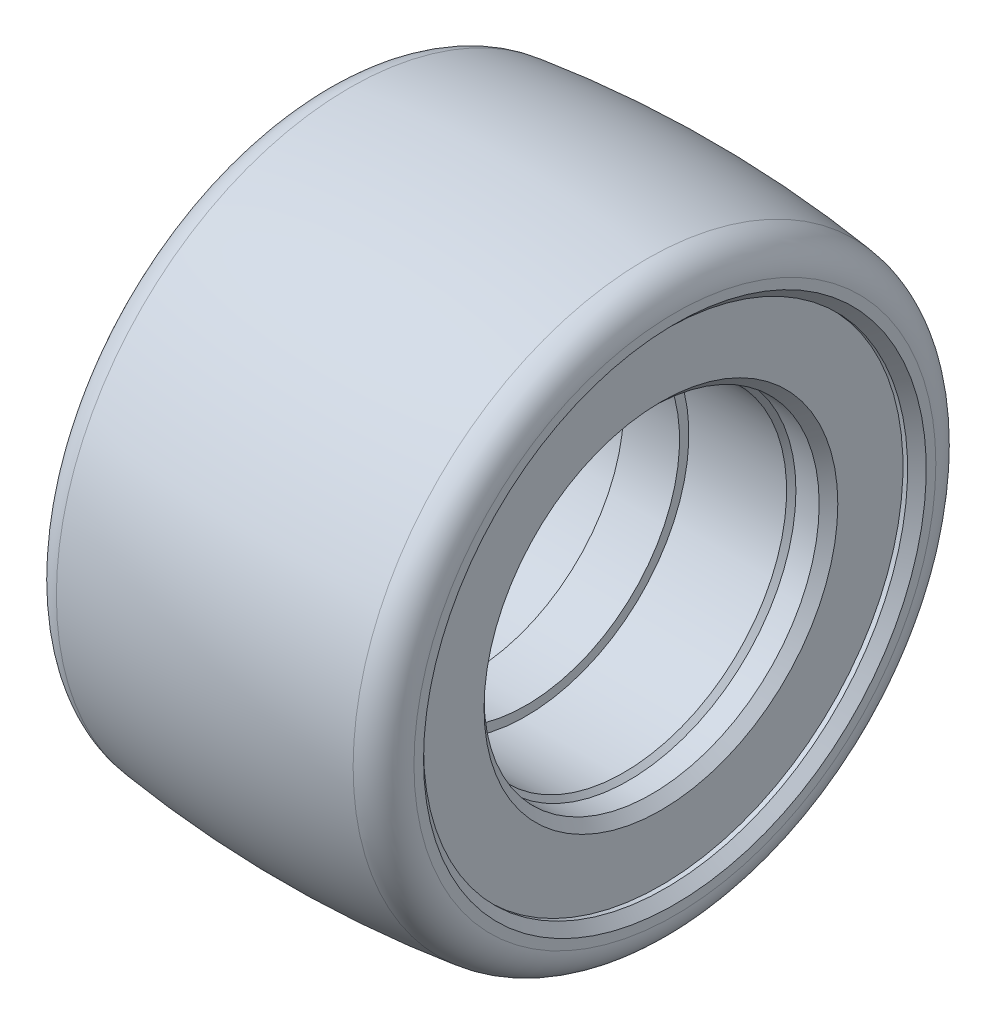
from build123d import *

# Parameters (mm, degrees)
CHAMFER1_SIZE = 1
CHAMFER2_SIZE = 0.5
FILLET1_R     = 3.5


with BuildPart() as part:
    # Sketch1 → Revolve1 (revolve)
    with BuildSketch(Plane.XY, mode=Mode.PRIVATE) as revolve1_sk:
        Polygon((-14, 17.5), (-3, 17.5), (-3, 16.5), (3, 16.5), (3, 17.5), (14, 17.5), (14, 18), (17.5, 18), (17.5, 26), (19, 26), (19, 32.5), (-19, 32.5), (-19, 26), (-17.5, 26), (-17.5, 18), (-14, 18), align=None)
    revolve(revolve1_sk.sketch.rotate(Axis((-17.6, 0, 0), (1, 0, 0)), 90), axis=Axis((-17.6, 0, 0), (1, 0, 0)))

    # Sketch2 → Cut-Revolve1 (revolve, cut)
    with BuildSketch(Plane.XY):
        with BuildLine():
            Line((-19, 46.076365747), (19, 46.076365747))
            Line((19, 46.076365747), (19, 31.076365747))
            ThreePointArc((19, 31.076365747), (0, 32.5), (-19, 31.076365747))
            Line((-19, 31.076365747), (-19, 46.076365747))
        make_face()
    revolve(axis=Axis((-17.6, 0, 0), (1, 0, 0)), mode=Mode.SUBTRACT)

    # Chamfer1
    chamfer1_edges = [part.edges().sort_by_distance(p)[0] for p in [
        (-19, 0, -26),
        (19, 0, -26),
        (17.5, 0, -18),
        (-17.5, 0, -18),
    ]]
    chamfer(chamfer1_edges, length=CHAMFER1_SIZE)

    # Chamfer2
    chamfer2_edges = [part.edges().sort_by_distance(p)[0] for p in [
        (14, 0, -17.5),
        (-14, 0, -17.5),
    ]]
    chamfer(chamfer2_edges, length=CHAMFER2_SIZE - 0.0001)  # a hair under: the kernel refuses the full size

    # Fillet1
    fillet1_edges = [part.edges().sort_by_distance(p)[0] for p in [
        (-19, -31.076365747, 0),
        (19, -31.076365747, 0),
    ]]
    fillet(fillet1_edges, radius=FILLET1_R)


solid = part.part
